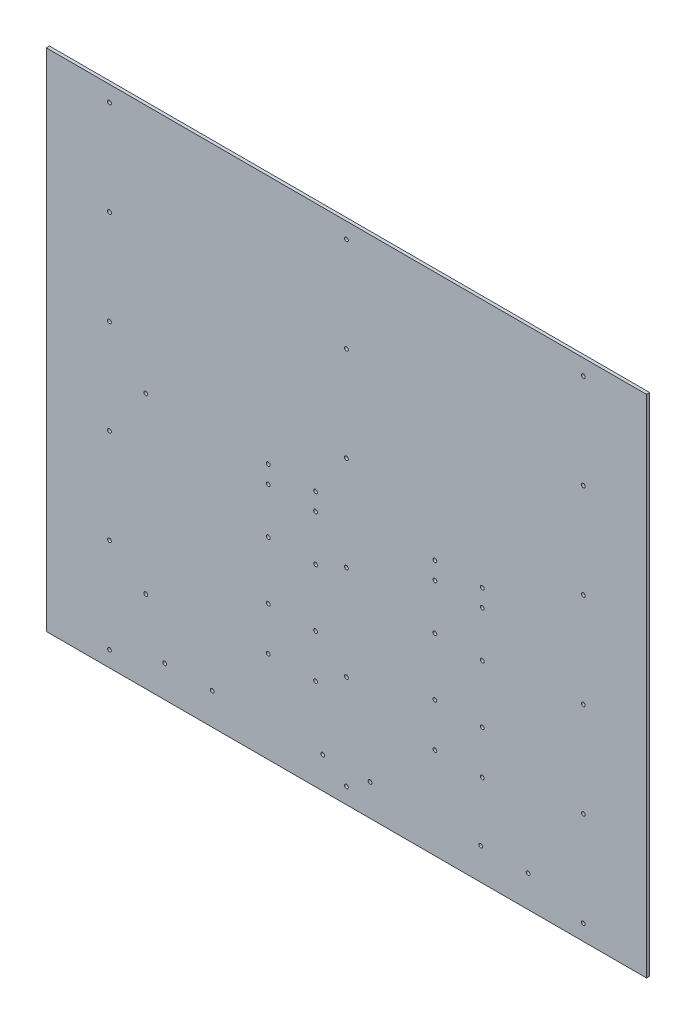
from build123d import *

# Parameters (mm, degrees)
SZKIC1_W                    = 1900
SZKIC1_H                    = 1600
DODANIE_WYCI_GNI_CIE1_DEPTH = 10
OTW_R_POD_RUB_M101_D        = 12
SZYK_LINIOWY1_COUNT         = 6
SZYK_LINIOWY1_PITCH         = 300
SZYK_LINIOWY1_COUNT_DIR2    = 3
SZYK_LINIOWY1_PITCH_DIR2    = 750
OTW_R_POD_RUB_M103_D        = 12
OTW_R_POD_RUB_M104_D        = 12
OTW_R_POD_RUB_M105_D        = 12
OTW_R_POD_RUB_M106_D        = 12


with BuildPart() as part:
    # Szkic1 → Dodanie-wyciągnięcie1 (new body)
    with BuildSketch(Plane.XY):
        Rectangle(SZKIC1_W, SZKIC1_H)
    extrude(amount=DODANIE_WYCI_GNI_CIE1_DEPTH)

    # Otwór pod śrubę M101 (through all)
    with Locations(Plane.XY.offset(10)):
        with Locations((-750, -750)):
            otw_r_pod_rub_m101 = Hole(OTW_R_POD_RUB_M101_D / 2)

    # Szyk liniowy1: Otw_r pod _rub_ M101 6 × 3
    with Locations(*[(j * SZYK_LINIOWY1_PITCH_DIR2, i * SZYK_LINIOWY1_PITCH, 0) for i in range(SZYK_LINIOWY1_COUNT) for j in range(SZYK_LINIOWY1_COUNT_DIR2) if (i, j) != (0, 0)]):
        add(otw_r_pod_rub_m101, mode=Mode.SUBTRACT)

    # Otwór pod śrubę M103 (through all)
    with Locations(Plane.XY.offset(10)):
        with Locations((-75, -700), (75, -700)):
            Hole(OTW_R_POD_RUB_M103_D / 2)

    # Otwór pod śrubę M104 (through all)
    with Locations(Plane.XY.offset(10)):
        with Locations((-575, -700), (-425, -700), (425, -700), (575, -700)):
            Hole(OTW_R_POD_RUB_M104_D / 2)

    # Otwór pod śrubę M105 (through all)
    with Locations(Plane.XY.offset(10)):
        with Locations((-634.999999999, -539.999999999), (-634.999999999, 10.000000001)):
            Hole(OTW_R_POD_RUB_M105_D / 2)

    # Otwór pod śrubę M106 (through all)
    with Locations(Plane.XY.offset(10)):
        with Locations((-247.5, -510), (-97.5, -510), (-97.5, -372.5), (-247.5, -372.5), (-97.5, -190), (-247.5, -190), (-247.5, -45), (-97.5, -45), (-97.5, 10), (-247.5, 10), (280, 10), (430, 10), (430, -45), (280, -45), (280, -190), (430, -190), (280, -372.5), (430, -372.5), (430, -510), (280, -510)):
            Hole(OTW_R_POD_RUB_M106_D / 2)


solid = part.part
